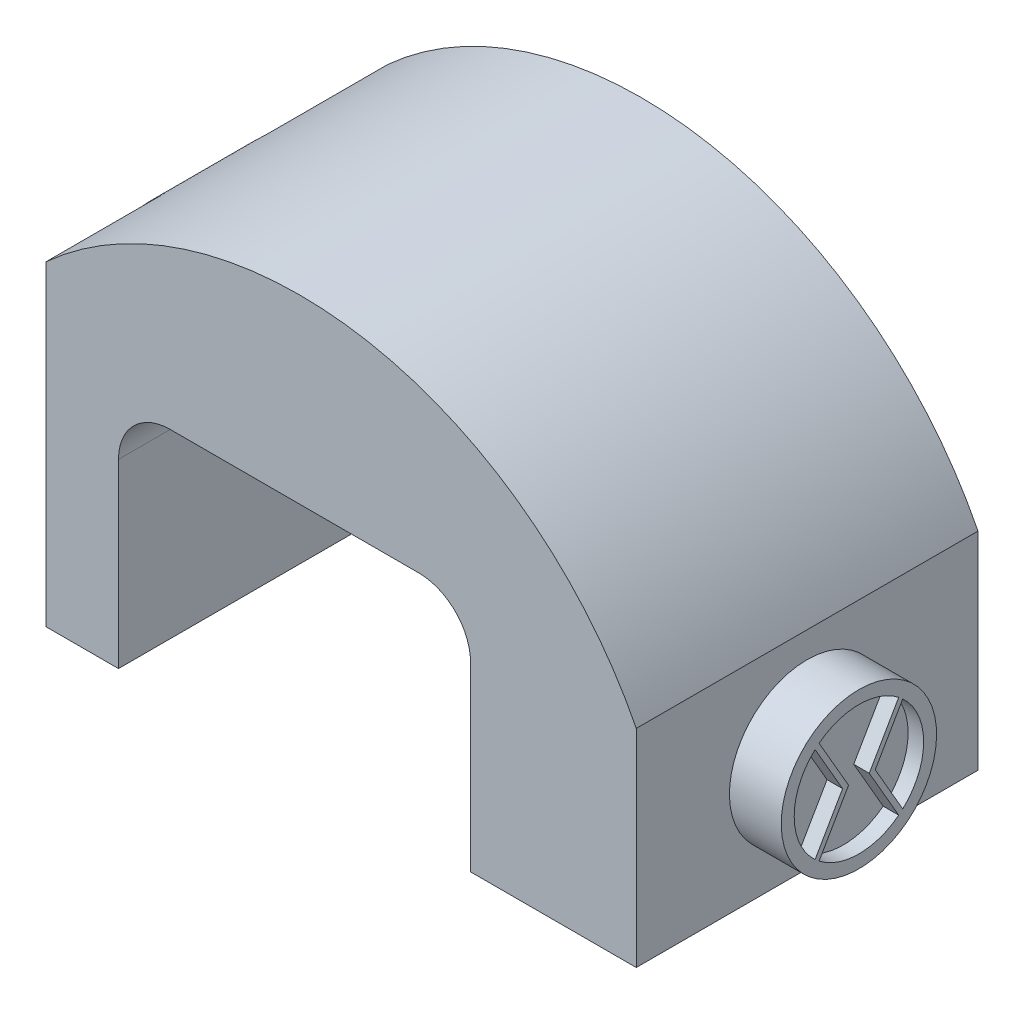
from build123d import *

# Parameters (mm, degrees)
BOSS_EXTRUDE1_DEPTH = 66
SKETCH4_R           = 15
BOSS_EXTRUDE2_DEPTH = 10
CUT_EXTRUDE2_DEPTH  = 108.615054709
SKETCH5_W           = 16
SKETCH5_H           = 23
CUT_EXTRUDE3_DEPTH  = 128.988280714
SKETCH6_W           = 10
SKETCH6_H           = 10
BOSS_EXTRUDE3_DEPTH = 5
SKETCH7_W           = 12
SKETCH7_H           = 12
BOSS_EXTRUDE4_DEPTH = 5
CUT_EXTRUDE4_DEPTH  = 3


with BuildPart() as part:
    # Sketch2 → Boss-Extrude1 (new body)
    with BuildSketch(Plane.XY):
        with BuildLine():
            ThreePointArc((65, 0), (38.160843726, 29.198871234), (-1.89e-07, 40))
            ThreePointArc((-1.89e-07, 40), (-38.160843886, 29.198871136), (-65, 0))
            Line((-65, 0), (-65, -40))
            Line((-65, -40), (65, -40))
            Line((65, -40), (65, 0))
        make_face()
    extrude(amount=BOSS_EXTRUDE1_DEPTH)

    # Sketch4 → Boss-Extrude2 (add)
    with BuildSketch(Plane(origin=(65, 0, 0), x_dir=(0, 0, -1), z_dir=(1, 0, 0))):
        with Locations((-33, -20)):
            Circle(SKETCH4_R)
    extrude(amount=BOSS_EXTRUDE2_DEPTH)

    # Sketch3 → Cut-Extrude2 (cut, through all)
    with BuildSketch(Plane.XY.offset(66)):
        with BuildLine():
            Line((-25, 5), (23, 5))
            ThreePointArc((23, 5), (30.071067812, 2.071067812), (33, -5))
            Line((33, -5), (33, -40))
            Line((33, -40), (-35, -40))
            Line((-35, -40), (-35, -5))
            ThreePointArc((-35, -5), (-32.071067812, 2.071067812), (-25, 5))
        make_face()
    extrude(amount=-CUT_EXTRUDE2_DEPTH, mode=Mode.SUBTRACT)

    # Sketch5 → Cut-Extrude3 (cut, through all)
    with BuildSketch(Plane.XZ.offset(40)):
        with Locations((-57, 54.5)):
            Rectangle(SKETCH5_W, SKETCH5_H)
        with Locations((-57, 11.5)):
            Rectangle(SKETCH5_W, SKETCH5_H)
    extrude(amount=-CUT_EXTRUDE3_DEPTH, mode=Mode.SUBTRACT)

    # Sketch6 → Boss-Extrude3 (add)
    with BuildSketch(Plane.XZ.offset(40)):
        with Locations((-48.5, 33)):
            Rectangle(SKETCH6_W, SKETCH6_H)
    extrude(amount=BOSS_EXTRUDE3_DEPTH)

    # Sketch7 → Boss-Extrude4 (add)
    with BuildSketch(Plane.XZ.offset(40)):
        with Locations((41.5, 13.9)):
            Rectangle(SKETCH7_W, SKETCH7_H)
        with Locations((41.5, 52.1)):
            Rectangle(SKETCH7_W, SKETCH7_H)
    extrude(amount=BOSS_EXTRUDE4_DEPTH)

    # Sketch8 → Cut-Extrude4 (cut)
    with BuildSketch(Plane(origin=(75, 0, 0), x_dir=(0, 0, -1), z_dir=(1, 0, 0))):
        with BuildLine():
            Line((-40.689709202, -10.145134583), (-35, -20))
            Line((-35, -20), (-40.689709202, -29.854865417))
            ThreePointArc((-40.689709202, -29.854865417), (-33, -32.5), (-25.310290798, -29.854865417))
            Line((-25.310290798, -29.854865417), (-31, -20))
            Line((-31, -20), (-25.310290798, -10.145134583))
            ThreePointArc((-25.310290798, -10.145134583), (-33, -7.5), (-40.689709202, -10.145134583))
        make_face()
        with BuildLine():
            Line((-36.154700538, -20), (-41.464916663, -10.802435872))
            ThreePointArc((-41.464916663, -10.802435872), (-45.5, -20), (-41.464916663, -29.197564128))
            Line((-41.464916663, -29.197564128), (-36.154700538, -20))
        make_face()
        with BuildLine():
            ThreePointArc((-24.535083337, -29.197564128), (-20.5, -20), (-24.535083337, -10.802435872))
            Line((-24.535083337, -10.802435872), (-29.845299462, -20))
            Line((-29.845299462, -20), (-24.535083337, -29.197564128))
        make_face()
    extrude(amount=-CUT_EXTRUDE4_DEPTH, mode=Mode.SUBTRACT)


solid = part.part
